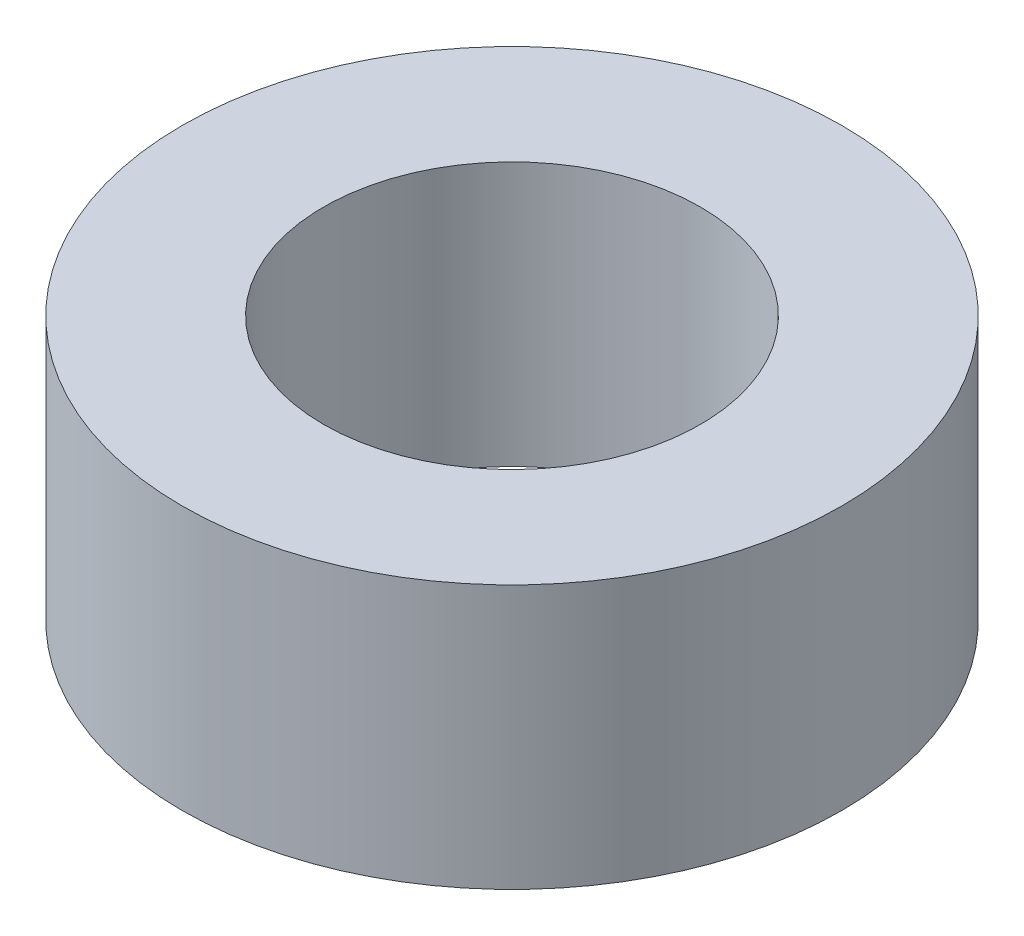
from build123d import *

# Parameters (mm, degrees)
SKETCH1_R           = 17.5
BOSS_EXTRUDE1_DEPTH = 14
SKETCH2_R           = 10
CUT_EXTRUDE1_DEPTH  = 29.434134416


with BuildPart() as part:
    # Sketch1 → Boss-Extrude1 (new body)
    with BuildSketch(Plane(origin=(0, 0, 0), x_dir=(1, 0, 0), z_dir=(0, 1, 0))):
        Circle(SKETCH1_R)
    extrude(amount=BOSS_EXTRUDE1_DEPTH)

    # Sketch2 → Cut-Extrude1 (cut, through all)
    with BuildSketch(Plane(origin=(0, 0, 0), x_dir=(1, 0, 0), z_dir=(0, 1, 0))):
        Circle(SKETCH2_R)
    extrude(amount=CUT_EXTRUDE1_DEPTH, mode=Mode.SUBTRACT)


solid = part.part
